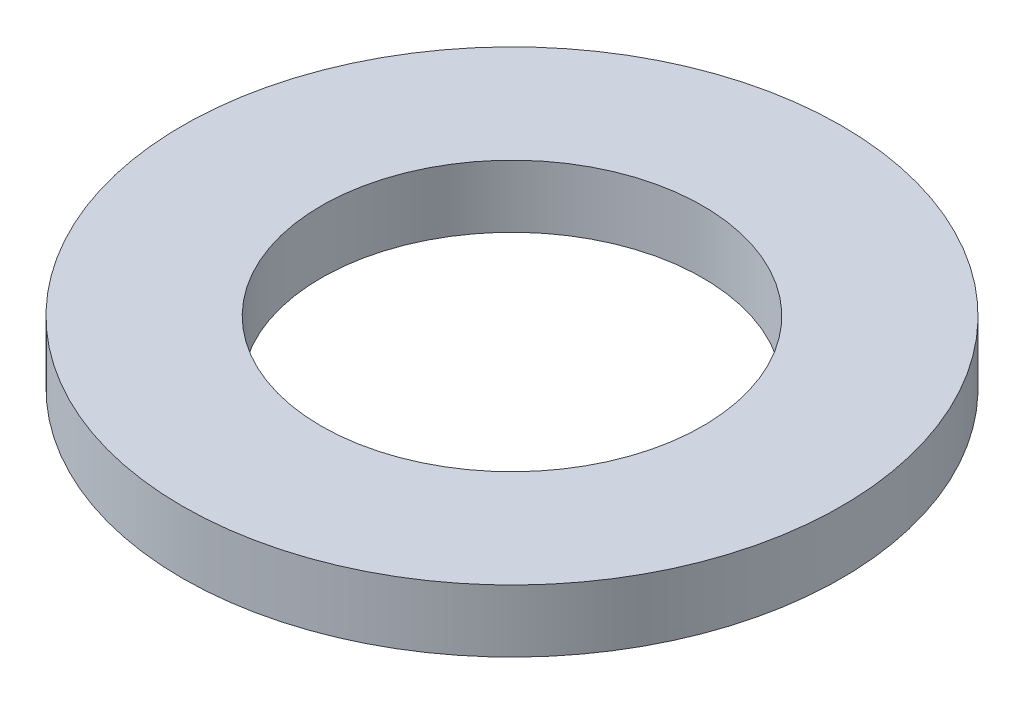
from build123d import *

# Parameters (mm, degrees)
SKETCH1_R           = 47.5
BOSS_EXTRUDE1_DEPTH = 9
SKETCH2_R           = 27.5
CUT_EXTRUDE1_DEPTH  = 68.775364256


with BuildPart() as part:
    # Sketch1 → Boss-Extrude1 (new body)
    with BuildSketch(Plane(origin=(0, 0, 0), x_dir=(1, 0, 0), z_dir=(0, 1, 0))):
        Circle(SKETCH1_R)
    extrude(amount=BOSS_EXTRUDE1_DEPTH)

    # Sketch2 → Cut-Extrude1 (cut, through all)
    with BuildSketch(Plane(origin=(0, 0, 0), x_dir=(1, 0, 0), z_dir=(0, 1, 0))):
        Circle(SKETCH2_R)
    extrude(amount=CUT_EXTRUDE1_DEPTH, mode=Mode.SUBTRACT)


solid = part.part
